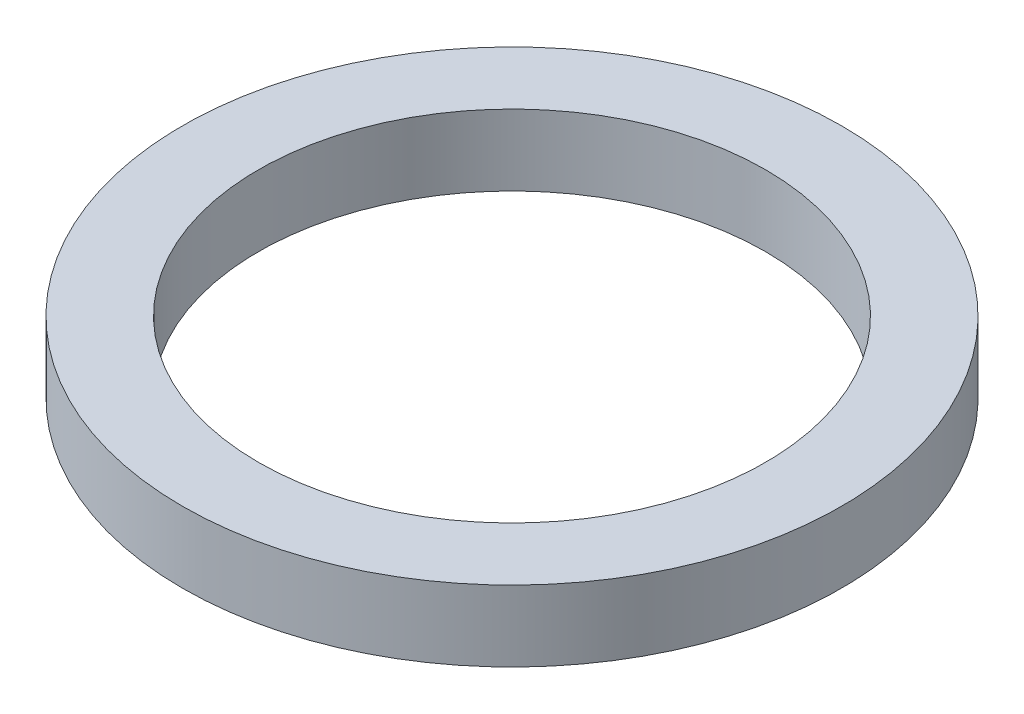
from build123d import *

# Parameters (mm, degrees)
SKETCH1_R           = 32.5
SKETCH1_R_2         = 25
BOSS_EXTRUDE1_DEPTH = 3.5


with BuildPart() as part:
    # Sketch1 → Boss-Extrude1 (new, symmetric)
    with BuildSketch(Plane(origin=(0, 0, 0), x_dir=(1, 0, 0), z_dir=(0, 1, 0))):
        Circle(SKETCH1_R)
        Circle(SKETCH1_R_2, mode=Mode.SUBTRACT)
    extrude(amount=BOSS_EXTRUDE1_DEPTH, both=True)


solid = part.part
